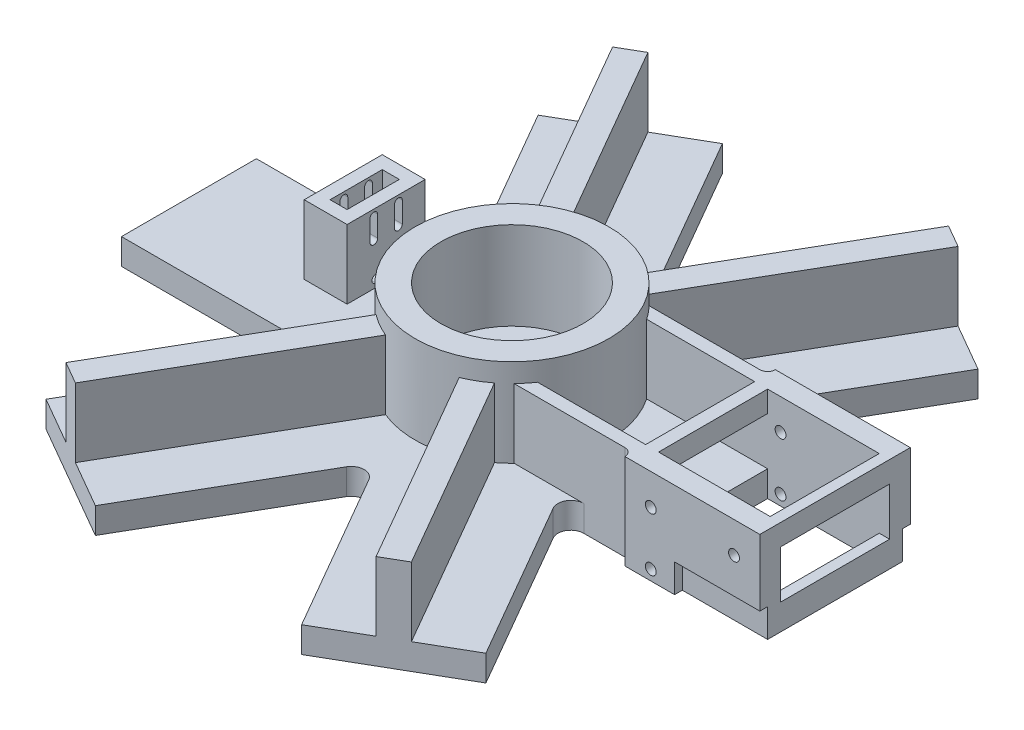
from build123d import *

# Parameters (mm, degrees)
AUFSATZ_LINEAR_AUSTRAGEN1_DEPTH  = 10
SKIZZE2_R                        = 37.5
SKIZZE2_R_2                      = 27.5
AUFSATZ_LINEAR_AUSTRAGEN2_DEPTH  = 34
AUFSATZ_LINEAR_AUSTRAGEN3_DEPTH  = 35.4
SKIZZE4_W                        = 47.2
SKIZZE4_H                        = 42.2
SCHNITT_LINEAR_AUSTRAGEN1_DEPTH  = 178.743130331
SKIZZE8_W                        = 16.6
SKIZZE8_H                        = 30.2
SKIZZE8_W_2                      = 6.6
SKIZZE8_H_2                      = 20.2
AUFSATZ_LINEAR_AUSTRAGEN4_DEPTH  = 26.7
SCHNITT_LINEAR_AUSTRAGEN6_REACH  = 240.528
SKIZZE11_W                       = 45.873433193
SKIZZE11_H                       = 5
AUFSATZ_LINEAR_AUSTRAGEN5_DEPTH  = 26.7
SKIZZE12_W                       = 52.2
SKIZZE12_H                       = 52.2
SCHNITT_LINEAR_AUSTRAGEN7_DEPTH  = 8.7
SKIZZE13_W                       = 4
SKIZZE13_H                       = 52.2
AUFSATZ_LINEAR_AUSTRAGEN6_DEPTH  = 36.7
SCHNITT_LINEAR_AUSTRAGEN8_REACH  = 283.337
SKIZZE14_W                       = 42.2
SKIZZE14_H                       = 18.5
SKIZZE15_W                       = 52.2
SKIZZE15_H                       = 3
AUFSATZ_LINEAR_AUSTRAGEN7_DEPTH  = 36.7
VERRUNDUNG1_R                    = 3
SCHNITT_LINEAR_AUSTRAGEN9_REACH  = 202.455
SKIZZE16_R                       = 2.1
SKIZZE17_W                       = 33
SKIZZE17_H                       = 3
SCHNITT_LINEAR_AUSTRAGEN10_DEPTH = 11


with BuildPart() as part:
    # Skizze1 → Aufsatz-Linear austragen1 (new body)
    with BuildSketch(Plane(origin=(0, 0, 0), x_dir=(1, 0, 0), z_dir=(0, 1, 0))):
        with BuildLine():
            Line((-125, 26.1), (-125, -26.1))
            Line((-125, -26.1), (-53.866780115, -26.1))
            ThreePointArc((-53.866780115, -26.1), (-49.536653096, -28.6), (-49.536653096, -33.6))
            Line((-49.536653096, -33.6), (-85.103263039, -95.203175473))
            Line((-85.103263039, -95.203175473), (-39.896736961, -121.303175473))
            Line((-39.896736961, -121.303175473), (-4.330127019, -59.7))
            ThreePointArc((-4.330127019, -59.7), (0, -57.2), (4.330127019, -59.7))
            Line((4.330127019, -59.7), (39.896736961, -121.303175473))
            Line((39.896736961, -121.303175473), (85.103263039, -95.203175473))
            Line((85.103263039, -95.203175473), (49.536653096, -33.6))
            ThreePointArc((49.536653096, -33.6), (49.536653096, -28.6), (53.866780115, -26.1))
            Line((53.866780115, -26.1), (125, -26.1))
            Line((125, -26.1), (125, 26.1))
            Line((125, 26.1), (53.866780115, 26.1))
            ThreePointArc((53.866780115, 26.1), (49.536653096, 28.6), (49.536653096, 33.6))
            Line((49.536653096, 33.6), (85.103263039, 95.203175473))
            Line((85.103263039, 95.203175473), (39.896736961, 121.303175473))
            Line((39.896736961, 121.303175473), (4.330127019, 59.7))
            ThreePointArc((4.330127019, 59.7), (0, 57.2), (-4.330127019, 59.7))
            Line((-4.330127019, 59.7), (-39.896736961, 121.303175473))
            Line((-39.896736961, 121.303175473), (-85.103263039, 95.203175473))
            Line((-85.103263039, 95.203175473), (-49.536653096, 33.6))
            ThreePointArc((-49.536653096, 33.6), (-49.536653096, 28.6), (-53.866780115, 26.1))
            Line((-53.866780115, 26.1), (-125, 26.1))
        make_face()
    extrude(amount=AUFSATZ_LINEAR_AUSTRAGEN1_DEPTH)

    # Skizze2 → Aufsatz-Linear austragen2 (add)
    with BuildSketch(Plane(origin=(0, 10, 0), x_dir=(1, 0, 0), z_dir=(0, 1, 0))):
        with Locations(Location((0, 0, 0), (0, 0, 90))):
            Circle(SKIZZE2_R)
        with Locations(Location((0, 0, 0), (0, 0, 270))):
            Circle(SKIZZE2_R_2, mode=Mode.SUBTRACT)
    extrude(amount=AUFSATZ_LINEAR_AUSTRAGEN2_DEPTH)

    # Skizze3 → Aufsatz-Linear austragen3 (add)
    with BuildSketch(Plane(origin=(0, 10, 0), x_dir=(1, 0, 0), z_dir=(0, 1, 0))):
        Polygon((125, 26.1), (72.8, 26.1), (72.8, -26.1), (125, -26.1), (125, -21.1), (77.8, -21.1), (77.8, 21.1), (125, 21.1), align=None)
    extrude(amount=AUFSATZ_LINEAR_AUSTRAGEN3_DEPTH)

    # Skizze4 → Schnitt-Linear austragen1 (cut, through all)
    with BuildSketch(Plane(origin=(0, 10, 0), x_dir=(1, 0, 0), z_dir=(0, 1, 0))):
        with Locations((101.4, 0)):
            Rectangle(SKIZZE4_W, SKIZZE4_H)
    extrude(amount=-SCHNITT_LINEAR_AUSTRAGEN1_DEPTH, mode=Mode.SUBTRACT)

    # Skizze8 → Aufsatz-Linear austragen4 (add)
    with BuildSketch(Plane(origin=(0, 10, 0), x_dir=(1, 0, 0), z_dir=(0, 1, 0))):
        with Locations((-67, 10)):
            Rectangle(SKIZZE8_W, SKIZZE8_H)
        with Locations((-67, 10)):
            Rectangle(SKIZZE8_W_2, SKIZZE8_H_2, mode=Mode.SUBTRACT)
    extrude(amount=AUFSATZ_LINEAR_AUSTRAGEN4_DEPTH)

    # Schnitt-Linear austragen6: up to this face of the body (flat: up to its plane)
    schnitt_linear_austragen6_end = Plane(part.part.faces().sort_by_distance((-58.7, 23.35, -10))[0])
    # Skizze10 → Schnitt-Linear austragen6 (cut, up to the picked face)
    with BuildSketch(Plane.ZY.offset(75.3), mode=Mode.PRIVATE) as schnitt_linear_austragen6_sk1:
        with BuildLine():
            Line((-13.25, 34.2), (-13.25, 26.2))
            ThreePointArc((-13.25, 26.2), (-14.75, 24.7), (-16.25, 26.2))
            Line((-16.25, 26.2), (-16.25, 34.2))
            ThreePointArc((-16.25, 34.2), (-14.75, 35.7), (-13.25, 34.2))
        make_face()
    schnitt_linear_austragen6_tool1 = split(extrude(schnitt_linear_austragen6_sk1.sketch, amount=-SCHNITT_LINEAR_AUSTRAGEN6_REACH, mode=Mode.PRIVATE), bisect_by=schnitt_linear_austragen6_end, keep=Keep.BOTH, mode=Mode.PRIVATE)
    # Skizze10 → Schnitt-Linear austragen6 (cut, up to the picked face)
    with BuildSketch(Plane.ZY.offset(75.3), mode=Mode.PRIVATE) as schnitt_linear_austragen6_sk2:
        with BuildLine():
            Line((-3.75, 34.2), (-3.75, 26.2))
            ThreePointArc((-3.75, 26.2), (-5.25, 24.7), (-6.75, 26.2))
            Line((-6.75, 26.2), (-6.75, 34.2))
            ThreePointArc((-6.75, 34.2), (-5.25, 35.7), (-3.75, 34.2))
        make_face()
    schnitt_linear_austragen6_tool2 = split(extrude(schnitt_linear_austragen6_sk2.sketch, amount=-SCHNITT_LINEAR_AUSTRAGEN6_REACH, mode=Mode.PRIVATE), bisect_by=schnitt_linear_austragen6_end, keep=Keep.BOTH, mode=Mode.PRIVATE)
    # Skizze10 → Schnitt-Linear austragen6 (cut, up to the picked face)
    with BuildSketch(Plane.ZY.offset(75.3), mode=Mode.PRIVATE) as schnitt_linear_austragen6_sk3:
        with BuildLine():
            Line((-14, 14.5), (-6, 14.5))
            ThreePointArc((-6, 14.5), (-4.5, 13), (-6, 11.5))
            Line((-6, 11.5), (-14, 11.5))
            ThreePointArc((-14, 11.5), (-15.5, 13), (-14, 14.5))
        make_face()
    schnitt_linear_austragen6_tool3 = split(extrude(schnitt_linear_austragen6_sk3.sketch, amount=-SCHNITT_LINEAR_AUSTRAGEN6_REACH, mode=Mode.PRIVATE), bisect_by=schnitt_linear_austragen6_end, keep=Keep.BOTH, mode=Mode.PRIVATE)
    add(schnitt_linear_austragen6_tool1.solids().sort_by(Axis((-75.3, 30.2, -14.75), (1, 0, 0)))[0], mode=Mode.SUBTRACT)
    add(schnitt_linear_austragen6_tool2.solids().sort_by(Axis((-75.3, 30.2, -5.25), (1, 0, 0)))[0], mode=Mode.SUBTRACT)
    add(schnitt_linear_austragen6_tool3.solids().sort_by(Axis((-75.3, 13, -10), (1, 0, 0)))[0], mode=Mode.SUBTRACT)

    # Skizze11 → Aufsatz-Linear austragen5 (add)
    with BuildSketch(Plane(origin=(0, 10, 0), x_dir=(1, 0, 0), z_dir=(0, 1, 0))):
        with BuildLine():
            Line((-66.830127019, 105.753175473), (-58.169872981, 110.753175473))
            Line((-58.169872981, 110.753175473), (-14.252458915, 34.685982974))
            ThreePointArc((-14.252458915, 34.685982974), (-18.75, 32.475952642), (-22.912712953, 29.685982974))
            Line((-22.912712953, 29.685982974), (-66.830127019, 105.753175473))
        make_face()
        with BuildLine():
            Line((58.169872981, 110.753175473), (14.252458915, 34.685982974))
            ThreePointArc((14.252458915, 34.685982974), (18.75, 32.475952642), (22.912712953, 29.685982974))
            Line((22.912712953, 29.685982974), (66.830127019, 105.753175473))
            Line((66.830127019, 105.753175473), (58.169872981, 110.753175473))
        make_face()
        with BuildLine():
            Line((-58.169872981, -110.753175473), (-14.252458915, -34.685982974))
            ThreePointArc((-14.252458915, -34.685982974), (-18.75, -32.475952642), (-22.912712953, -29.685982974))
            Line((-22.912712953, -29.685982974), (-66.830127019, -105.753175473))
            Line((-66.830127019, -105.753175473), (-58.169872981, -110.753175473))
        make_face()
        with BuildLine():
            Line((66.830127019, -105.753175473), (58.169872981, -110.753175473))
            Line((58.169872981, -110.753175473), (14.252458915, -34.685982974))
            ThreePointArc((14.252458915, -34.685982974), (18.75, -32.475952642), (22.912712953, -29.685982974))
            Line((22.912712953, -29.685982974), (66.830127019, -105.753175473))
        make_face()
        with Locations((49.863283404, 23.6)):
            Rectangle(SKIZZE11_W, SKIZZE11_H)
        with Locations((49.863283404, -23.6)):
            Rectangle(SKIZZE11_W, SKIZZE11_H)
    extrude(amount=AUFSATZ_LINEAR_AUSTRAGEN5_DEPTH)

    # Skizze12 → Schnitt-Linear austragen7 (cut)
    with BuildSketch(Plane(origin=(0, 45.4, 0), x_dir=(1, 0, 0), z_dir=(0, 1, 0))):
        with Locations((98.9, 0)):
            Rectangle(SKIZZE12_W, SKIZZE12_H)
    extrude(amount=-SCHNITT_LINEAR_AUSTRAGEN7_DEPTH, mode=Mode.SUBTRACT)

    # Skizze13 → Aufsatz-Linear austragen6 (add)
    with BuildSketch(Plane(origin=(0, 36.7, 0), x_dir=(1, 0, 0), z_dir=(0, 1, 0))):
        with Locations((123, 0)):
            Rectangle(SKIZZE13_W, SKIZZE13_H)
    extrude(amount=-AUFSATZ_LINEAR_AUSTRAGEN6_DEPTH)

    # Schnitt-Linear austragen8: up to this face of the body (flat: up to its plane)
    schnitt_linear_austragen8_end = Plane(part.part.faces().sort_by_distance((72.8, 23.35, 0))[0])
    # Skizze14 → Schnitt-Linear austragen8 (cut, up to the picked face)
    with BuildSketch(Plane(origin=(125, 0, 0), x_dir=(0, 0, -1), z_dir=(1, 0, 0)), mode=Mode.PRIVATE) as schnitt_linear_austragen8_sk1:
        with Locations((0, 19.25)):
            Rectangle(SKIZZE14_W, SKIZZE14_H)
    schnitt_linear_austragen8_tool1 = split(extrude(schnitt_linear_austragen8_sk1.sketch, amount=-SCHNITT_LINEAR_AUSTRAGEN8_REACH, mode=Mode.PRIVATE), bisect_by=schnitt_linear_austragen8_end, keep=Keep.BOTH, mode=Mode.PRIVATE)
    add(schnitt_linear_austragen8_tool1.solids().sort_by(Axis((125, 19.25, 0), (-1, 0, 0)))[0], mode=Mode.SUBTRACT)

    # Skizze15 → Aufsatz-Linear austragen7 (add)
    with BuildSketch(Plane(origin=(0, 36.7, 0), x_dir=(1, 0, 0), z_dir=(0, 1, 0))):
        with Locations((98.9, 27.6)):
            Rectangle(SKIZZE15_W, SKIZZE15_H)
        with Locations((98.9, -27.6)):
            Rectangle(SKIZZE15_W, SKIZZE15_H)
    extrude(amount=-AUFSATZ_LINEAR_AUSTRAGEN7_DEPTH)

    # Verrundung1
    verrundung1_edges = [part.edges().sort_by_distance(p)[0] for p in [
        (72.8, 18.35, -26.1),
        (72.8, 18.35, 26.1),
    ]]
    fillet(verrundung1_edges, radius=VERRUNDUNG1_R - 0.0001)  # a hair under: the kernel refuses the full size

    # Schnitt-Linear austragen9: up to this face of the body (flat: up to its plane)
    schnitt_linear_austragen9_end = Plane(part.part.faces().sort_by_distance((98.9, 18.35, -29.1))[0])
    # Skizze16 → Schnitt-Linear austragen9 (cut, up to the picked face)
    with BuildSketch(Plane.XY.offset(29.1), mode=Mode.PRIVATE) as schnitt_linear_austragen9_sk1:
        with Locations((82.8, 24.7)):
            Circle(SKIZZE16_R)
    schnitt_linear_austragen9_tool1 = split(extrude(schnitt_linear_austragen9_sk1.sketch, amount=-SCHNITT_LINEAR_AUSTRAGEN9_REACH, mode=Mode.PRIVATE), bisect_by=schnitt_linear_austragen9_end, keep=Keep.BOTH, mode=Mode.PRIVATE)
    # Skizze16 → Schnitt-Linear austragen9 (cut, up to the picked face)
    with BuildSketch(Plane.XY.offset(29.1), mode=Mode.PRIVATE) as schnitt_linear_austragen9_sk2:
        with Locations((115, 24.7)):
            Circle(SKIZZE16_R)
    schnitt_linear_austragen9_tool2 = split(extrude(schnitt_linear_austragen9_sk2.sketch, amount=-SCHNITT_LINEAR_AUSTRAGEN9_REACH, mode=Mode.PRIVATE), bisect_by=schnitt_linear_austragen9_end, keep=Keep.BOTH, mode=Mode.PRIVATE)
    # Skizze16 → Schnitt-Linear austragen9 (cut, up to the picked face)
    with BuildSketch(Plane.XY.offset(29.1), mode=Mode.PRIVATE) as schnitt_linear_austragen9_sk3:
        with Locations((82.8, 4)):
            Circle(SKIZZE16_R)
    schnitt_linear_austragen9_tool3 = split(extrude(schnitt_linear_austragen9_sk3.sketch, amount=-SCHNITT_LINEAR_AUSTRAGEN9_REACH, mode=Mode.PRIVATE), bisect_by=schnitt_linear_austragen9_end, keep=Keep.BOTH, mode=Mode.PRIVATE)
    add(schnitt_linear_austragen9_tool1.solids().sort_by(Axis((82.8, 24.7, 29.1), (0, 0, -1)))[0], mode=Mode.SUBTRACT)
    add(schnitt_linear_austragen9_tool2.solids().sort_by(Axis((115, 24.7, 29.1), (0, 0, -1)))[0], mode=Mode.SUBTRACT)
    add(schnitt_linear_austragen9_tool3.solids().sort_by(Axis((82.8, 4, 29.1), (0, 0, -1)))[0], mode=Mode.SUBTRACT)

    # Skizze17 → Schnitt-Linear austragen10 (cut)
    with BuildSketch(Plane.XZ):
        with Locations((108.5, 27.6)):
            Rectangle(SKIZZE17_W, SKIZZE17_H)
        with Locations((108.5, -27.6)):
            Rectangle(SKIZZE17_W, SKIZZE17_H)
    extrude(amount=-SCHNITT_LINEAR_AUSTRAGEN10_DEPTH, mode=Mode.SUBTRACT)


solid = part.part
